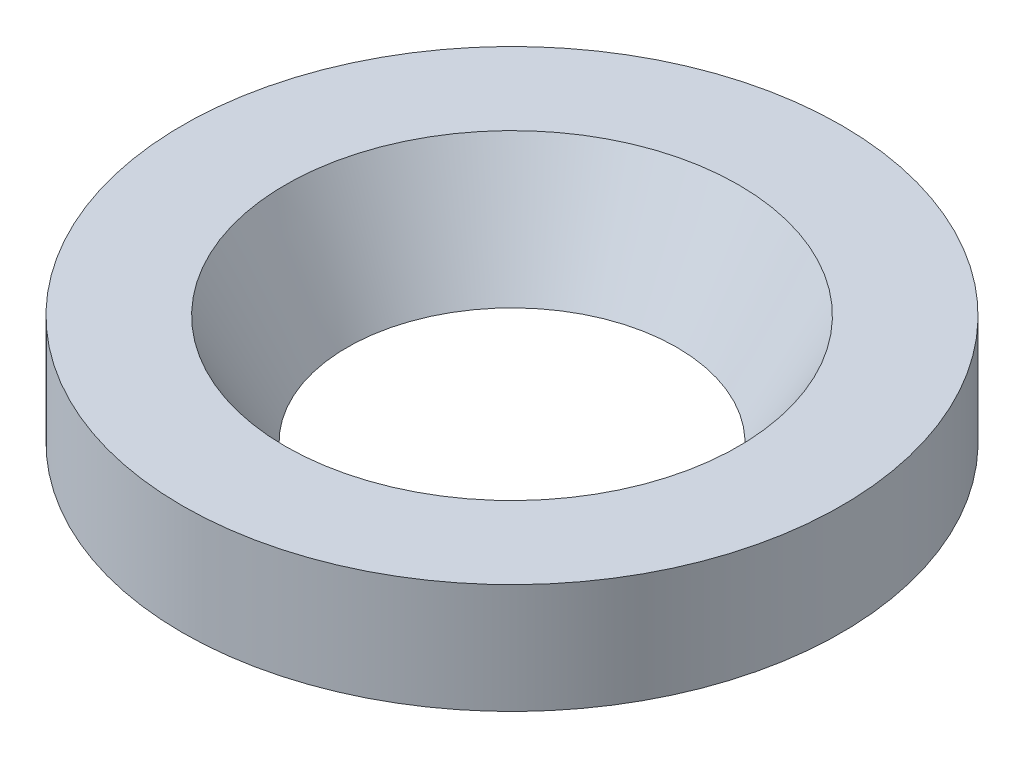
from build123d import *

# Parameters (mm, degrees)
SKETCH1_R           = 6
SKETCH1_R_2         = 3
BOSS_EXTRUDE1_DEPTH = 2
CHAMFER1_SIZE       = 2
CHAMFER1_SIZE_2     = 1.125


with BuildPart() as part:
    # Sketch1 → Boss-Extrude1 (new body)
    with BuildSketch(Plane(origin=(0, 0, 0), x_dir=(1, 0, 0), z_dir=(0, 1, 0))):
        with Locations(Location((0, 0, 0), (0, 0, 270))):
            Circle(SKETCH1_R)
        with Locations(Location((0, 0, 0), (0, 0, 270))):
            Circle(SKETCH1_R_2, mode=Mode.SUBTRACT)
    extrude(amount=BOSS_EXTRUDE1_DEPTH)

    # Chamfer1
    # the kernel refuses this chamfer: 2, 1.125 mm, written as the material it takes off along each edge
    with BuildSketch(Plane(origin=(0, 2, 0), x_dir=(0, 0, 1), z_dir=(-1, 0, 0))) as chamfer1_piece_1:
        Polygon((3, -CHAMFER1_SIZE), (3 + CHAMFER1_SIZE_2, 0), (3, 0), align=None)
    revolve(axis=Axis((0, 2, 0), (0, 1, 0)), mode=Mode.SUBTRACT)


solid = part.part
